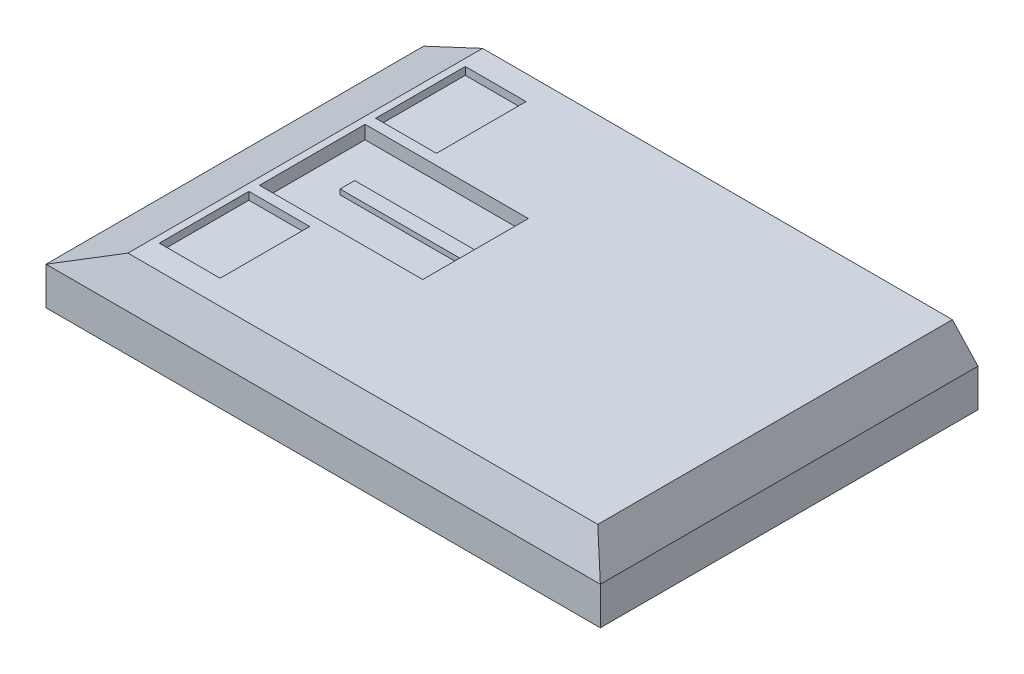
from build123d import *

# Parameters (mm, degrees)
SKETCH1_W           = 219.964
SKETCH1_H           = 149.86
BOSS_EXTRUDE1_DEPTH = 14.986
SKETCH4_W           = 24.13
SKETCH4_H           = 35.56
CUT_EXTRUDE1_DEPTH  = 3.048
SKETCH5_W           = 64.77
SKETCH5_H           = 41.91
CUT_EXTRUDE2_DEPTH  = 5.334
SKETCH6_W           = 50.8
SKETCH6_H           = 5.7912
BOSS_EXTRUDE2_DEPTH = 2.032


with BuildPart() as part:
    # Sketch1 → Boss-Extrude1 (new body)
    with BuildSketch(Plane(origin=(0, 0, 0), x_dir=(1, 0, 0), z_dir=(0, 1, 0))):
        with Locations((-109.982, -74.93)):
            Rectangle(SKETCH1_W, SKETCH1_H)
    extrude(amount=BOSS_EXTRUDE1_DEPTH)

    # Sketch2 → Loft1 section 0
    with BuildSketch(Plane(origin=(0, 14.986, 0), x_dir=(1, 0, 0), z_dir=(0, 1, 0))):
        with BuildLine():
            Line((0, 0), (-219.964, 0))
            Line((-219.964, 0), (-219.964, -149.86))
            Line((-219.964, -149.86), (0, -149.86))
            Line((0, -149.86), (0, 0))
        make_face()
    # Sketch3 → Loft1 section 1
    with BuildSketch(Plane(origin=(0, 30.48, 0), x_dir=(1, 0, 0), z_dir=(0, 1, 0))):
        with BuildLine():
            Line((-192.024, -4.572), (-5.588, -4.572))
            Line((-5.588, -4.572), (-5.588, -145.288))
            Line((-5.588, -145.288), (-192.024, -145.288))
            Line((-192.024, -145.288), (-192.024, -4.572))
        make_face()
    loft()

    # Sketch4 → Cut-Extrude1 (cut)
    with BuildSketch(Plane(origin=(0, 30.48, 0), x_dir=(1, 0, 0), z_dir=(0, 1, 0))):
        with Locations((-177.165, -117.856)):
            Rectangle(SKETCH4_W, SKETCH4_H)
        with Locations((-177.165, -32.004)):
            Rectangle(SKETCH4_W, SKETCH4_H)
    extrude(amount=-CUT_EXTRUDE1_DEPTH, mode=Mode.SUBTRACT)

    # Sketch5 → Cut-Extrude2 (cut)
    with BuildSketch(Plane(origin=(0, 30.48, 0), x_dir=(1, 0, 0), z_dir=(0, 1, 0))):
        with Locations((-156.845, -74.93)):
            Rectangle(SKETCH5_W, SKETCH5_H)
    extrude(amount=-CUT_EXTRUDE2_DEPTH, mode=Mode.SUBTRACT)

    # Sketch6 → Boss-Extrude2 (add)
    with BuildSketch(Plane(origin=(0, 25.146, 0), x_dir=(1, 0, 0), z_dir=(0, 1, 0))):
        with Locations((-149.86, -74.9554)):
            Rectangle(SKETCH6_W, SKETCH6_H)
    extrude(amount=BOSS_EXTRUDE2_DEPTH)


solid = part.part
